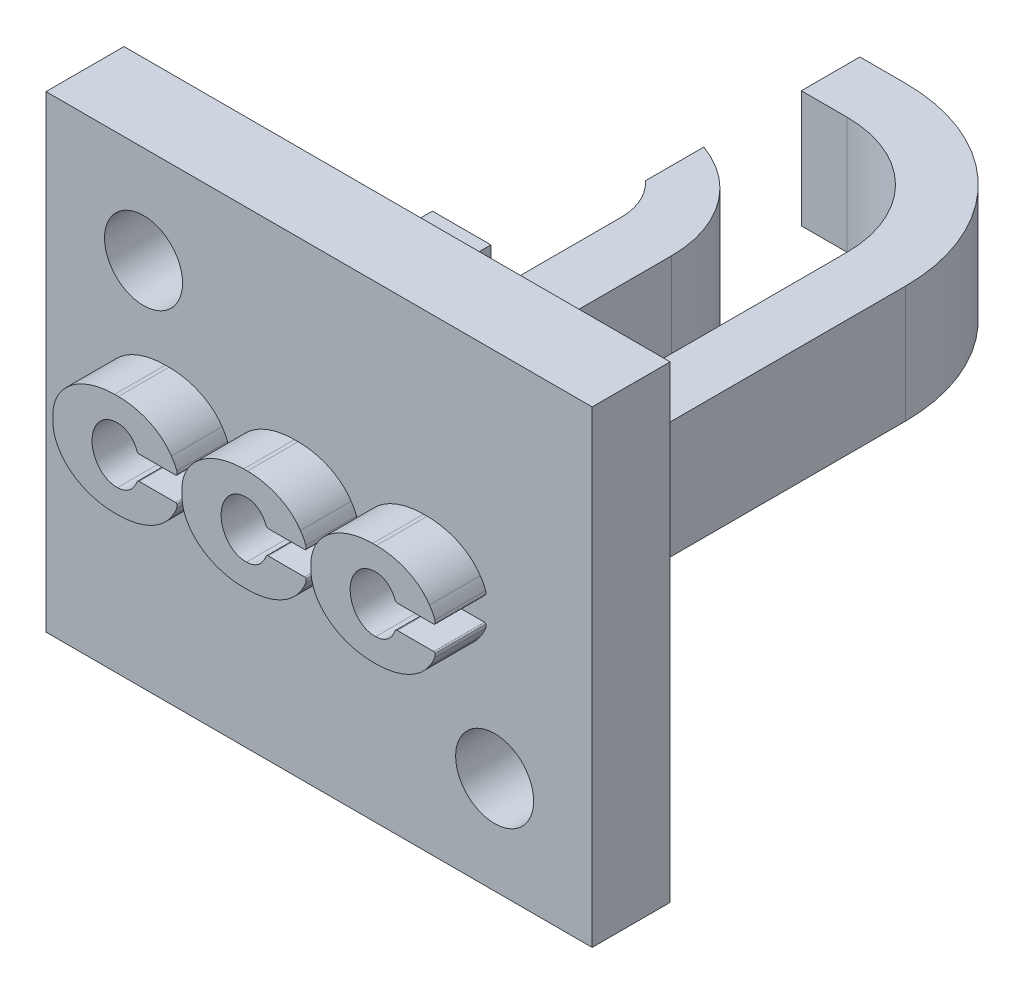
from build123d import *

# Parameters (mm, degrees)
SKETCH1_W           = 15
SKETCH1_H           = 12
BOSS_EXTRUDE1_DEPTH = 2
BOSS_EXTRUDE2_DEPTH = 2
SKETCH3_W           = 1.5
SKETCH3_H           = 4.8
BOSS_EXTRUDE3_DEPTH = 1.5
FILLET3_START       = -1.5
FILLET3_DEPTH       = 3
FILLET4_R           = 3
FILLET5_R           = 3
FILLET6_R           = 4.5
SKETCH4_W           = 2
SKETCH4_H           = 12
CUT_EXTRUDE1_DEPTH  = 1
SKETCH5_R           = 1
CUT_EXTRUDE2_DEPTH  = 17.731407672
CUT_EXTRUDE3_START  = -0.7
CUT_EXTRUDE3_DEPTH  = 0.7


with BuildPart() as part:
    # Sketch1 → Boss-Extrude1 (new body)
    with BuildSketch(Plane.XY):
        Rectangle(SKETCH1_W, SKETCH1_H)
    extrude(amount=BOSS_EXTRUDE1_DEPTH)

    # Sketch2 → Boss-Extrude2 (add)
    with BuildSketch(Plane.XY.offset(2)):
        with BuildLine():
            Line((-0.500488048, 0.447210694), (0.435347045, 0.447210694))
            ThreePointArc((0.435347045, 0.447210694), (0.453657173, 0.45529852), (0.464590943, 0.472065344))
            ThreePointArc((0.464590943, 0.472065344), (0.467777397, 0.516057125), (0.460402384, 0.559543208))
            ThreePointArc((0.460402384, 0.559543208), (0.399954535, 0.692528449), (0.323240273, 0.816842321))
            add(Edge.make_bspline(
                [(0.323240273, 0.816842321), (-0.095057279, 1.457976678), (-1.037858727, 1.457976694)],
                knots=[0.342748392, 0.342748392, 0.342748392, 1.381331674, 1.381331674, 1.381331674], degree=2, weights=[1, 0.868170932, 1]))
            Line((-1.037858727, 1.457976694), (-1.131479815, 1.457976694))
            add(Edge.make_bspline(
                [(-1.131479815, 1.457976694), (-2.717136663, 1.457976694), (-2.717136676, 0.206821629)],
                knots=[4.81203319, 4.81203319, 4.81203319, 6.344970318, 6.344970318, 6.344970318], degree=2, weights=[1, 0.720364545, 1]))
            Line((-2.717136676, 0.206821629), (-2.717136676, 0.076691364))
            add(Edge.make_bspline(
                [(-2.717136676, 0.076691364), (-2.717136676, -1.174463735), (-1.131479784, -1.174463712)],
                knots=[3.079807634, 3.079807634, 3.079807634, 4.61274479, 4.61274479, 4.61274479], degree=2, weights=[1, 0.720364535, 1]))
            Line((-1.131479784, -1.174463712), (-1.037858761, -1.174463712))
            add(Edge.make_bspline(
                [(-1.037858761, -1.174463712), (-0.095057289, -1.174463712), (0.323240273, -0.533329339)],
                knots=[1.760260959, 1.760260959, 1.760260959, 2.798844261, 2.798844261, 2.798844261], degree=2, weights=[1, 0.868170926, 1]))
            ThreePointArc((0.323240273, -0.533329339), (0.396990367, -0.414226505), (0.455654338, -0.287013692))
            ThreePointArc((0.455654338, -0.287013692), (0.467247325, -0.238690378), (0.465485217, -0.189027163))
            ThreePointArc((0.465485217, -0.189027163), (0.453480667, -0.168104183), (0.430820669, -0.159833461))
            Line((0.430820669, -0.159833461), (-0.50048808, -0.159833461))
            ThreePointArc((-0.50048808, -0.159833461), (-0.53825591, -0.17183426), (-0.562169449, -0.203434431))
            add(Edge.make_bspline(
                [(-1.058661028, -0.574317984), (-0.693553117, -0.574677188), (-0.562169449, -0.203434431)],
                knots=[5.955155363, 5.955155363, 5.955155363, 7.020735544, 7.020735544, 7.020735544], degree=2, weights=[1, 0.86139323, 1]))
            add(Edge.make_bspline(
                [(-1.118454184, 0.858318186), (-1.740543918, 0.826860552), (-1.710558048, 0.108403064), (-1.680572179, -0.610054424), (-1.058661028, -0.574317984)],
                knots=[3.181025595, 3.181025595, 3.181025595, 4.754799698, 4.754799698, 6.328573801, 6.328573801, 6.328573801], degree=2, weights=[1, 0.706053195, 1, 0.706053195, 1]))
            add(Edge.make_bspline(
                [(-0.562169449, 0.490811684), (-0.70840827, 0.904029734), (-1.118454184, 0.858318186)],
                knots=[2.404042417, 2.404042417, 2.404042417, 3.565685694, 3.565685694, 3.565685694], degree=2, weights=[1, 0.83601209, 1]))
            ThreePointArc((-0.562169449, 0.490811684), (-0.538255894, 0.459211502), (-0.500488048, 0.447210694))
        make_face()
        with BuildLine():
            Line((-3.808792647, 0.447210694), (-2.872957501, 0.447210694))
            ThreePointArc((-2.872957501, 0.447210694), (-2.854647373, 0.45529852), (-2.843713602, 0.472065344))
            ThreePointArc((-2.843713602, 0.472065344), (-2.840527149, 0.516057125), (-2.847902161, 0.559543208))
            ThreePointArc((-2.847902161, 0.559543208), (-2.90835001, 0.692528449), (-2.985064272, 0.816842321))
            add(Edge.make_bspline(
                [(-2.985064272, 0.816842321), (-3.403361825, 1.457976679), (-4.346163273, 1.457976694)],
                knots=[0.342748392, 0.342748392, 0.342748392, 1.381331674, 1.381331674, 1.381331674], degree=2, weights=[1, 0.868170932, 1]))
            Line((-4.346163273, 1.457976694), (-4.43978436, 1.457976694))
            add(Edge.make_bspline(
                [(-4.43978436, 1.457976694), (-6.025441208, 1.457976694), (-6.025441222, 0.206821629)],
                knots=[4.81203319, 4.81203319, 4.81203319, 6.344970318, 6.344970318, 6.344970318], degree=2, weights=[1, 0.720364545, 1]))
            Line((-6.025441222, 0.206821629), (-6.025441222, 0.076691364))
            add(Edge.make_bspline(
                [(-6.025441222, 0.076691364), (-6.025441222, -1.174463735), (-4.439784331, -1.174463712)],
                knots=[6.221400287, 6.221400287, 6.221400287, 7.754337442, 7.754337442, 7.754337442], degree=2, weights=[1, 0.720364536, 1]))
            Line((-4.439784331, -1.174463712), (-4.346163307, -1.174463712))
            add(Edge.make_bspline(
                [(-4.346163307, -1.174463712), (-3.403361835, -1.174463712), (-2.985064272, -0.533329339)],
                knots=[1.760260959, 1.760260959, 1.760260959, 2.798844261, 2.798844261, 2.798844261], degree=2, weights=[1, 0.868170926, 1]))
            ThreePointArc((-2.985064272, -0.533329339), (-2.911314179, -0.414226505), (-2.852650208, -0.287013692))
            ThreePointArc((-2.852650208, -0.287013692), (-2.84105722, -0.238690378), (-2.842819329, -0.189027163))
            ThreePointArc((-2.842819329, -0.189027163), (-2.854823879, -0.168104182), (-2.877483878, -0.159833461))
            Line((-2.877483878, -0.159833461), (-3.808792626, -0.159833461))
            ThreePointArc((-3.808792626, -0.159833461), (-3.846560455, -0.17183426), (-3.870473995, -0.203434431))
            add(Edge.make_bspline(
                [(-4.366965573, -0.574317984), (-4.001857663, -0.574677188), (-3.870473995, -0.203434431)],
                knots=[2.81356271, 2.81356271, 2.81356271, 3.87914289, 3.87914289, 3.87914289], degree=2, weights=[1, 0.86139323, 1]))
            add(Edge.make_bspline(
                [(-4.42675873, 0.858318186), (-5.048848463, 0.826860552), (-5.018862594, 0.108403064), (-4.988876725, -0.610054424), (-4.366965573, -0.574317984)],
                knots=[3.181025595, 3.181025595, 3.181025595, 4.754799698, 4.754799698, 6.328573801, 6.328573801, 6.328573801], degree=2, weights=[1, 0.706053195, 1, 0.706053195, 1]))
            add(Edge.make_bspline(
                [(-3.870473995, 0.490811684), (-4.016712815, 0.904029734), (-4.42675873, 0.858318186)],
                knots=[5.54563507, 5.54563507, 5.54563507, 6.707278348, 6.707278348, 6.707278348], degree=2, weights=[1, 0.83601209, 1]))
            ThreePointArc((-3.870473995, 0.490811684), (-3.846560461, 0.459211518), (-3.808792647, 0.447210694))
        make_face()
        with BuildLine():
            Line((2.807816498, 0.447210694), (3.743651591, 0.447210694))
            ThreePointArc((3.743651591, 0.447210694), (3.761961719, 0.45529852), (3.772895489, 0.472065344))
            ThreePointArc((3.772895489, 0.472065344), (3.776081943, 0.516057125), (3.76870693, 0.559543208))
            ThreePointArc((3.76870693, 0.559543208), (3.708259081, 0.692528449), (3.631544819, 0.816842321))
            add(Edge.make_bspline(
                [(3.631544819, 0.816842321), (3.213247267, 1.457976678), (2.270445819, 1.457976694)],
                knots=[0.342748392, 0.342748392, 0.342748392, 1.381331674, 1.381331674, 1.381331674], degree=2, weights=[1, 0.868170932, 1]))
            Line((2.270445819, 1.457976694), (2.176824731, 1.457976694))
            add(Edge.make_bspline(
                [(2.176824731, 1.457976694), (0.591167883, 1.457976694), (0.59116787, 0.206821629)],
                knots=[4.81203319, 4.81203319, 4.81203319, 6.344970318, 6.344970318, 6.344970318], degree=2, weights=[1, 0.720364545, 1]))
            Line((0.59116787, 0.206821629), (0.59116787, 0.076691364))
            add(Edge.make_bspline(
                [(0.59116787, 0.076691364), (0.59116787, -1.174463735), (2.176824762, -1.174463712)],
                knots=[3.079807634, 3.079807634, 3.079807634, 4.61274479, 4.61274479, 4.61274479], degree=2, weights=[1, 0.720364535, 1]))
            Line((2.176824762, -1.174463712), (2.270445785, -1.174463712))
            add(Edge.make_bspline(
                [(2.270445785, -1.174463712), (3.213247257, -1.174463712), (3.631544819, -0.533329339)],
                knots=[1.760260959, 1.760260959, 1.760260959, 2.798844261, 2.798844261, 2.798844261], degree=2, weights=[1, 0.868170926, 1]))
            ThreePointArc((3.631544819, -0.533329339), (3.705294913, -0.414226505), (3.763958884, -0.287013692))
            ThreePointArc((3.763958884, -0.287013692), (3.775551871, -0.238690378), (3.773789763, -0.189027163))
            ThreePointArc((3.773789763, -0.189027163), (3.761785213, -0.168104183), (3.739125215, -0.159833461))
            Line((3.739125215, -0.159833461), (2.807816466, -0.159833461))
            ThreePointArc((2.807816466, -0.159833461), (2.770048636, -0.17183426), (2.746135097, -0.203434431))
            add(Edge.make_bspline(
                [(2.249643518, -0.574317984), (2.614751429, -0.574677188), (2.746135097, -0.203434431)],
                knots=[2.81356271, 2.81356271, 2.81356271, 3.87914289, 3.87914289, 3.87914289], degree=2, weights=[1, 0.86139323, 1]))
            add(Edge.make_bspline(
                [(2.189850362, 0.858318186), (1.567760628, 0.826860552), (1.597746498, 0.108403064), (1.627732367, -0.610054424), (2.249643518, -0.574317984)],
                knots=[0.039432941, 0.039432941, 0.039432941, 1.613207044, 1.613207044, 3.186981147, 3.186981147, 3.186981147], degree=2, weights=[1, 0.706053195, 1, 0.706053195, 1]))
            add(Edge.make_bspline(
                [(2.746135097, 0.490811684), (2.599896276, 0.904029734), (2.189850362, 0.858318186)],
                knots=[2.404042417, 2.404042417, 2.404042417, 3.565685694, 3.565685694, 3.565685694], degree=2, weights=[1, 0.83601209, 1]))
            ThreePointArc((2.746135097, 0.490811684), (2.770048652, 0.459211502), (2.807816498, 0.447210694))
        make_face()
    extrude(amount=BOSS_EXTRUDE2_DEPTH)

    # Sketch3 → Boss-Extrude3 (add, symmetric)
    with BuildSketch(Plane(origin=(0, 0, 0), x_dir=(1, 0, 0), z_dir=(0, 1, 0))):
        Polygon((1.833716, 0), (3.333716, 0), (3.333716, 13.7), (-2.337662633, 13.7), (-2.337662633, 12.2), (1.833716, 12.2), align=None)
        with Locations((-3.644025381, 2.4)):
            Rectangle(SKETCH3_W, SKETCH3_H)
        Polygon((-1.837662633, 0), (-0.337662633, 0), (-0.337662633, 9.7), (-2.337662633, 9.7), (-2.337662633, 8.2), (-1.837662633, 8.2), align=None)
    extrude(amount=BOSS_EXTRUDE3_DEPTH, both=True)

    # Fillet3: read off the stored shape, not the designer's step
    # Fillet3 outline → Fillet3 (add)
    with BuildSketch(Plane(origin=(0, 0, 0), x_dir=(1, 0, 0), z_dir=(0, 1, 0)).offset(FILLET3_START)):
        with BuildLine():
            Line((-1.837662633, 8.2), (-2.337662633, 8.2))
            ThreePointArc((-2.337662633, 8.2), (-1.968356239, 7.694338447), (-1.837662633, 7.081966011))
            Line((-1.837662633, 7.081966011), (-1.837662633, 8.2))
        make_face()
    extrude(amount=FILLET3_DEPTH)

    # Fillet4
    # the kernel refuses this fillet: 3 mm, written as the material it takes off along each edge
    with BuildSketch(Plane(origin=(-0.337662633, -8.571067812, -9.7), x_dir=(0, 0, 1), z_dir=(0, 1, 0))) as fillet4_piece_1:
        with BuildLine():
            CenterArc((2.828427125, -3), FILLET4_R, 90, 70.528779366)
            Line((0, -2), (-0.056568542, -1.98))
            ThreePointArc((-0.056568542, -1.98), (-0.06, -1), (-0.06, 0))
            Line((-0.06, 0), (0, 0.06))
            Line((0, 0.06), (2.828427125, 0.06))
            Line((2.828427125, 0.06), (2.828427125, 0))
        make_face()
    extrude(amount=17.142135624, mode=Mode.SUBTRACT)

    # Fillet5
    fillet5_edges = [part.edges().sort_by_distance(p)[0] for p in [
        (1.833716, 0, -12.2),
    ]]
    fillet(fillet5_edges, radius=FILLET5_R)

    # Fillet6
    fillet6_edges = [part.edges().sort_by_distance(p)[0] for p in [
        (3.333716, 0, -13.7),
    ]]
    fillet(fillet6_edges, radius=FILLET6_R)

    # Sketch4 → Cut-Extrude1 (cut)
    with BuildSketch(Plane(origin=(7.5, 0, 0), x_dir=(0, 0, -1), z_dir=(1, 0, 0))):
        with Locations((-1, 0)):
            Rectangle(SKETCH4_W, SKETCH4_H)
    extrude(amount=-CUT_EXTRUDE1_DEPTH, mode=Mode.SUBTRACT)

    # Sketch5 → Cut-Extrude2 (cut, through all)
    with BuildSketch(Plane(origin=(0, 0, 0), x_dir=(-1, 0, 0), z_dir=(0, 0, -1))):
        with Locations((-4, -3.5)):
            Circle(SKETCH5_R)
        with Locations((5, 3.5)):
            Circle(SKETCH5_R)
    extrude(amount=-CUT_EXTRUDE2_DEPTH, mode=Mode.SUBTRACT)

    # Sketch6 → Cut-Extrude3 (cut)
    with BuildSketch(Plane.XY.offset(4).offset(CUT_EXTRUDE3_START)):
        with BuildLine():
            Line((-3.808792647, 0.447210694), (-2.872957501, 0.447210694))
            ThreePointArc((-2.872957501, 0.447210694), (-2.854647373, 0.45529852), (-2.843713602, 0.472065344))
            ThreePointArc((-2.843713602, 0.472065344), (-2.840527149, 0.516057125), (-2.847902161, 0.559543208))
            ThreePointArc((-2.847902161, 0.559543208), (-2.90835001, 0.692528449), (-2.985064272, 0.816842321))
            add(Edge.make_bspline(
                [(-2.985064272, 0.816842321), (-3.403361825, 1.457976679), (-4.346163273, 1.457976694)],
                knots=[0.342748392, 0.342748392, 0.342748392, 1.381331674, 1.381331674, 1.381331674], degree=2, weights=[1, 0.868170932, 1]))
            Line((-4.346163273, 1.457976694), (-4.43978436, 1.457976694))
            add(Edge.make_bspline(
                [(-4.43978436, 1.457976694), (-6.025441208, 1.457976694), (-6.025441222, 0.206821629)],
                knots=[4.81203319, 4.81203319, 4.81203319, 6.344970318, 6.344970318, 6.344970318], degree=2, weights=[1, 0.720364545, 1]))
            Line((-6.025441222, 0.206821629), (-6.025441222, 0.076691364))
            add(Edge.make_bspline(
                [(-6.025441222, 0.076691364), (-6.025441222, -1.174463735), (-4.439784331, -1.174463712)],
                knots=[6.221400287, 6.221400287, 6.221400287, 7.754337442, 7.754337442, 7.754337442], degree=2, weights=[1, 0.720364536, 1]))
            Line((-4.439784331, -1.174463712), (-4.346163307, -1.174463712))
            add(Edge.make_bspline(
                [(-4.346163307, -1.174463712), (-3.403361835, -1.174463712), (-2.985064272, -0.533329339)],
                knots=[1.760260959, 1.760260959, 1.760260959, 2.798844261, 2.798844261, 2.798844261], degree=2, weights=[1, 0.868170926, 1]))
            ThreePointArc((-2.985064272, -0.533329339), (-2.911314179, -0.414226505), (-2.852650208, -0.287013692))
            ThreePointArc((-2.852650208, -0.287013692), (-2.84105722, -0.238690378), (-2.842819329, -0.189027163))
            ThreePointArc((-2.842819329, -0.189027163), (-2.854823879, -0.168104182), (-2.877483878, -0.159833461))
            Line((-2.877483878, -0.159833461), (-3.808792626, -0.159833461))
            ThreePointArc((-3.808792626, -0.159833461), (-3.846560455, -0.17183426), (-3.870473995, -0.203434431))
            add(Edge.make_bspline(
                [(-4.366965573, -0.574317984), (-4.001857663, -0.574677188), (-3.870473995, -0.203434431)],
                knots=[5.955155363, 5.955155363, 5.955155363, 7.020735544, 7.020735544, 7.020735544], degree=2, weights=[1, 0.86139323, 1]))
            add(Edge.make_bspline(
                [(-4.42675873, 0.858318186), (-5.048848463, 0.826860552), (-5.018862594, 0.108403064), (-4.988876725, -0.610054424), (-4.366965573, -0.574317984)],
                knots=[3.181025595, 3.181025595, 3.181025595, 4.754799698, 4.754799698, 6.328573801, 6.328573801, 6.328573801], degree=2, weights=[1, 0.706053195, 1, 0.706053195, 1]))
            add(Edge.make_bspline(
                [(-3.870473995, 0.490811684), (-4.016712815, 0.904029734), (-4.42675873, 0.858318186)],
                knots=[2.404042417, 2.404042417, 2.404042417, 3.565685694, 3.565685694, 3.565685694], degree=2, weights=[1, 0.83601209, 1]))
            ThreePointArc((-3.870473995, 0.490811684), (-3.846560461, 0.459211518), (-3.808792647, 0.447210694))
        make_face()
        with BuildLine():
            Line((-0.500488048, 0.447210694), (0.435347045, 0.447210694))
            ThreePointArc((0.435347045, 0.447210694), (0.453657173, 0.45529852), (0.464590943, 0.472065344))
            ThreePointArc((0.464590943, 0.472065344), (0.467777397, 0.516057125), (0.460402384, 0.559543208))
            ThreePointArc((0.460402384, 0.559543208), (0.399954535, 0.692528449), (0.323240273, 0.816842321))
            add(Edge.make_bspline(
                [(0.323240273, 0.816842321), (-0.095057279, 1.457976678), (-1.037858727, 1.457976694)],
                knots=[0.342748392, 0.342748392, 0.342748392, 1.381331674, 1.381331674, 1.381331674], degree=2, weights=[1, 0.868170932, 1]))
            Line((-1.037858727, 1.457976694), (-1.131479815, 1.457976694))
            add(Edge.make_bspline(
                [(-1.131479815, 1.457976694), (-2.717136663, 1.457976694), (-2.717136676, 0.206821629)],
                knots=[4.81203319, 4.81203319, 4.81203319, 6.344970318, 6.344970318, 6.344970318], degree=2, weights=[1, 0.720364545, 1]))
            Line((-2.717136676, 0.206821629), (-2.717136676, 0.076691364))
            add(Edge.make_bspline(
                [(-2.717136676, 0.076691364), (-2.717136676, -1.174463735), (-1.131479784, -1.174463712)],
                knots=[3.079807634, 3.079807634, 3.079807634, 4.61274479, 4.61274479, 4.61274479], degree=2, weights=[1, 0.720364535, 1]))
            Line((-1.131479784, -1.174463712), (-1.037858761, -1.174463712))
            add(Edge.make_bspline(
                [(-1.037858761, -1.174463712), (-0.095057289, -1.174463712), (0.323240273, -0.533329339)],
                knots=[1.760260959, 1.760260959, 1.760260959, 2.798844261, 2.798844261, 2.798844261], degree=2, weights=[1, 0.868170926, 1]))
            ThreePointArc((0.323240273, -0.533329339), (0.396990367, -0.414226505), (0.455654338, -0.287013692))
            ThreePointArc((0.455654338, -0.287013692), (0.467247325, -0.238690378), (0.465485217, -0.189027163))
            ThreePointArc((0.465485217, -0.189027163), (0.453480667, -0.168104183), (0.430820669, -0.159833461))
            Line((0.430820669, -0.159833461), (-0.50048808, -0.159833461))
            ThreePointArc((-0.50048808, -0.159833461), (-0.53825591, -0.17183426), (-0.562169449, -0.203434431))
            add(Edge.make_bspline(
                [(-1.058661028, -0.574317984), (-0.693553117, -0.574677188), (-0.562169449, -0.203434431)],
                knots=[5.955155363, 5.955155363, 5.955155363, 7.020735544, 7.020735544, 7.020735544], degree=2, weights=[1, 0.86139323, 1]))
            add(Edge.make_bspline(
                [(-1.118454184, 0.858318186), (-1.740543918, 0.826860552), (-1.710558048, 0.108403064), (-1.680572179, -0.610054424), (-1.058661028, -0.574317984)],
                knots=[3.181025595, 3.181025595, 3.181025595, 4.754799698, 4.754799698, 6.328573801, 6.328573801, 6.328573801], degree=2, weights=[1, 0.706053195, 1, 0.706053195, 1]))
            add(Edge.make_bspline(
                [(-0.562169449, 0.490811684), (-0.70840827, 0.904029734), (-1.118454184, 0.858318186)],
                knots=[2.404042417, 2.404042417, 2.404042417, 3.565685694, 3.565685694, 3.565685694], degree=2, weights=[1, 0.83601209, 1]))
            ThreePointArc((-0.562169449, 0.490811684), (-0.538255894, 0.459211502), (-0.500488048, 0.447210694))
        make_face()
        with BuildLine():
            Line((2.807816498, 0.447210694), (3.743651591, 0.447210694))
            ThreePointArc((3.743651591, 0.447210694), (3.761961719, 0.45529852), (3.772895489, 0.472065344))
            ThreePointArc((3.772895489, 0.472065344), (3.776081943, 0.516057125), (3.76870693, 0.559543208))
            ThreePointArc((3.76870693, 0.559543208), (3.708259081, 0.692528449), (3.631544819, 0.816842321))
            add(Edge.make_bspline(
                [(3.631544819, 0.816842321), (3.213247267, 1.457976678), (2.270445819, 1.457976694)],
                knots=[0.342748392, 0.342748392, 0.342748392, 1.381331674, 1.381331674, 1.381331674], degree=2, weights=[1, 0.868170932, 1]))
            Line((2.270445819, 1.457976694), (2.176824731, 1.457976694))
            add(Edge.make_bspline(
                [(2.176824731, 1.457976694), (0.591167883, 1.457976694), (0.59116787, 0.206821629)],
                knots=[4.81203319, 4.81203319, 4.81203319, 6.344970318, 6.344970318, 6.344970318], degree=2, weights=[1, 0.720364545, 1]))
            Line((0.59116787, 0.206821629), (0.59116787, 0.076691364))
            add(Edge.make_bspline(
                [(0.59116787, 0.076691364), (0.59116787, -1.174463735), (2.176824762, -1.174463712)],
                knots=[3.079807634, 3.079807634, 3.079807634, 4.61274479, 4.61274479, 4.61274479], degree=2, weights=[1, 0.720364535, 1]))
            Line((2.176824762, -1.174463712), (2.270445785, -1.174463712))
            add(Edge.make_bspline(
                [(2.270445785, -1.174463712), (3.213247257, -1.174463712), (3.631544819, -0.533329339)],
                knots=[1.760260959, 1.760260959, 1.760260959, 2.798844261, 2.798844261, 2.798844261], degree=2, weights=[1, 0.868170926, 1]))
            ThreePointArc((3.631544819, -0.533329339), (3.705294913, -0.414226505), (3.763958884, -0.287013692))
            ThreePointArc((3.763958884, -0.287013692), (3.775551871, -0.238690378), (3.773789763, -0.189027163))
            ThreePointArc((3.773789763, -0.189027163), (3.761785213, -0.168104183), (3.739125215, -0.159833461))
            Line((3.739125215, -0.159833461), (2.807816466, -0.159833461))
            ThreePointArc((2.807816466, -0.159833461), (2.770048636, -0.17183426), (2.746135097, -0.203434431))
            add(Edge.make_bspline(
                [(2.249643518, -0.574317984), (2.614751429, -0.574677188), (2.746135097, -0.203434431)],
                knots=[5.955155363, 5.955155363, 5.955155363, 7.020735544, 7.020735544, 7.020735544], degree=2, weights=[1, 0.86139323, 1]))
            add(Edge.make_bspline(
                [(2.189850362, 0.858318186), (1.567760628, 0.826860552), (1.597746498, 0.108403064), (1.627732367, -0.610054424), (2.249643518, -0.574317984)],
                knots=[3.181025595, 3.181025595, 3.181025595, 4.754799698, 4.754799698, 6.328573801, 6.328573801, 6.328573801], degree=2, weights=[1, 0.706053195, 1, 0.706053195, 1]))
            add(Edge.make_bspline(
                [(2.746135097, 0.490811684), (2.599896276, 0.904029734), (2.189850362, 0.858318186)],
                knots=[2.404042417, 2.404042417, 2.404042417, 3.565685694, 3.565685694, 3.565685694], degree=2, weights=[1, 0.83601209, 1]))
            ThreePointArc((2.746135097, 0.490811684), (2.770048652, 0.459211502), (2.807816498, 0.447210694))
        make_face()
    extrude(amount=CUT_EXTRUDE3_DEPTH, mode=Mode.SUBTRACT)


solid = part.part
